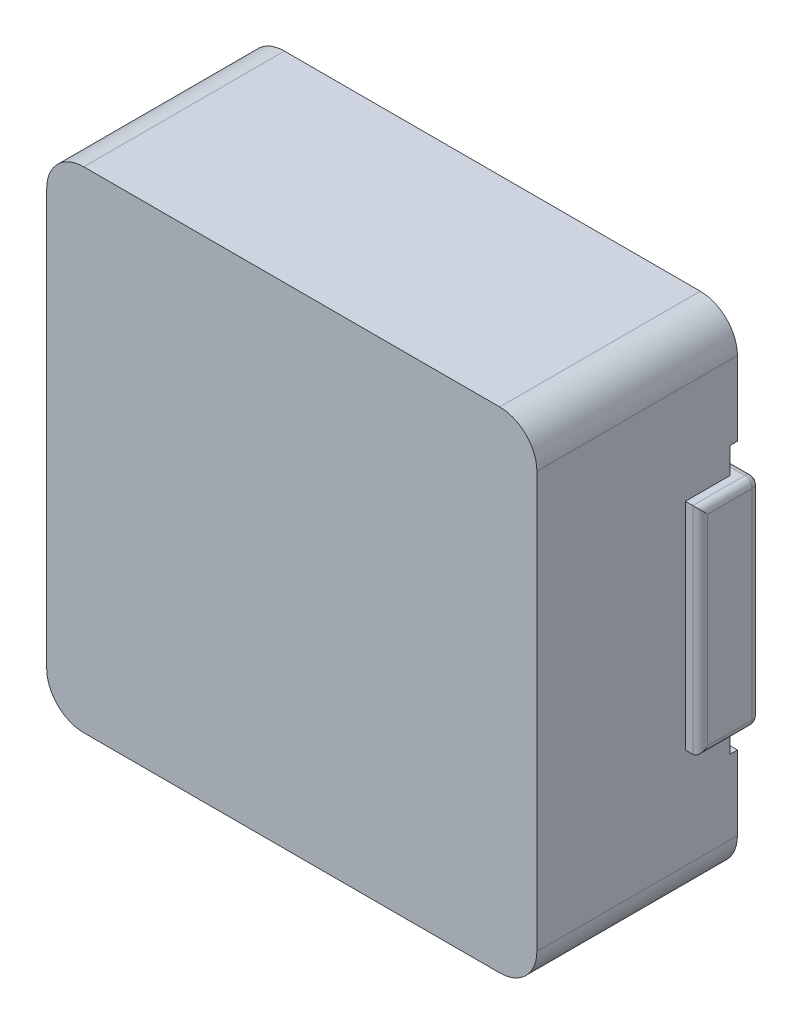
from build123d import *

# Parameters (mm, degrees)
BOSS_EXTRUDE1_START = 0.1
SKETCH1_W           = 6.6
SKETCH1_H           = 6.6
BOSS_EXTRUDE1_DEPTH = 2.7
CUT_EXTRUDE1_START  = 0.1
SKETCH2_W           = 4
SKETCH2_H           = 3.6
CUT_EXTRUDE1_DEPTH  = 0.1
SKETCH3_W           = 1.6
SKETCH3_H           = 2.9
BOSS_EXTRUDE2_DEPTH = 0.8
FILLET1_R           = 0.5
FILLET2_R           = 0.1


with BuildPart() as part:
    # Sketch1 → Boss-Extrude1 (new body)
    with BuildSketch(Plane.XY.offset(BOSS_EXTRUDE1_START)):
        Rectangle(SKETCH1_W, SKETCH1_H)
    extrude(amount=BOSS_EXTRUDE1_DEPTH)

    # Sketch2 → Cut-Extrude1 (cut)
    with BuildSketch(Plane.XY.offset(CUT_EXTRUDE1_START)):
        with Locations((-3.3, 0)):
            Rectangle(SKETCH2_W, SKETCH2_H)
    cut_extrude1 = extrude(amount=CUT_EXTRUDE1_DEPTH, mode=Mode.SUBTRACT)

    # Mirror1: Cut-Extrude1 across plane
    add(cut_extrude1.mirror(Plane(origin=(0, 0, 0), x_dir=(0, 0, 1), z_dir=(1, 0, 0))), mode=Mode.SUBTRACT)

    # Sketch3 → Boss-Extrude2 (add)
    with BuildSketch(Plane.XY):
        with Locations((-2.7, 0)):
            Rectangle(SKETCH3_W, SKETCH3_H)
    boss_extrude2 = extrude(amount=BOSS_EXTRUDE2_DEPTH)

    # Mirror2: Boss-Extrude2 across plane
    add(boss_extrude2.mirror(Plane(origin=(0, 0, 0), x_dir=(0, 0, 1), z_dir=(1, 0, 0))))

    # Fillet1
    fillet1_edges = [part.edges().sort_by_distance(p)[0] for p in [
        (3.3, -3.3, 1.45),
        (-3.3, -3.3, 1.45),
        (-3.3, 3.3, 1.45),
        (3.3, 3.3, 1.45),
    ]]
    fillet(fillet1_edges, radius=FILLET1_R)

    # Fillet2
    fillet2_edges = [part.edges().sort_by_distance(p)[0] for p in [
        (3.5, -1.45, 0.4),
        (3.5, 0, 0.8),
        (3.5, 1.45, 0.4),
        (2.7, 1.45, 0),
        (1.9, 0, 0),
        (2.7, -1.45, 0),
        (3.5, 0, 0),
        (-2.7, -1.45, 0),
        (-1.9, 0, 0),
        (-2.7, 1.45, 0),
        (-3.5, 1.45, 0.4),
        (-3.5, 0, 0.8),
        (-3.5, -1.45, 0.4),
        (-3.5, 0, 0),
        (-2.6, 1.45, 0.2),
    ]]
    fillet(fillet2_edges, radius=FILLET2_R - 0.0001)  # a hair under: the kernel refuses the full size


solid = part.part
